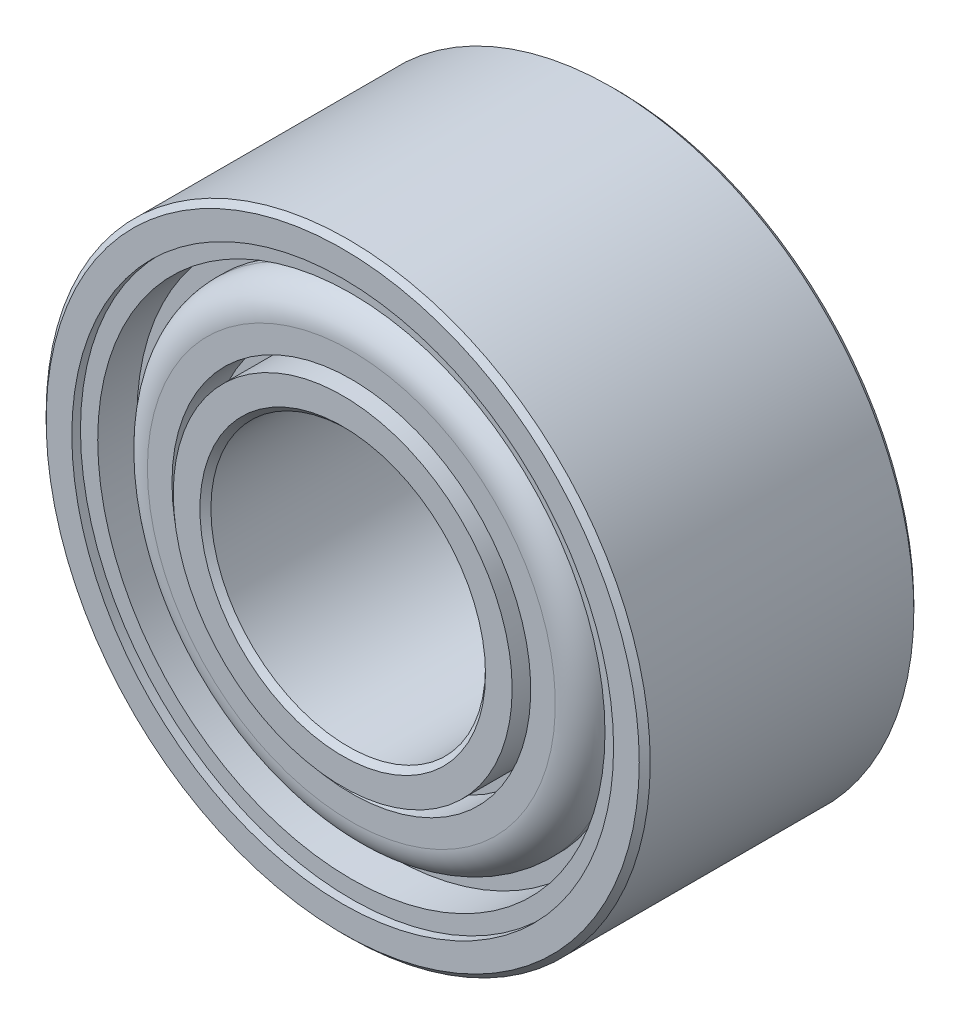
from build123d import *

# Parameters (mm, degrees)
SKETCH1_W     = 5
SKETCH1_H     = 3
FILLET1_R     = 0.6
CHAMFER1_SIZE = 0.1


with BuildPart() as part:
    # Sketch1 → Revolve1 (revolve)
    with BuildSketch(Plane(origin=(0, 0, 0), x_dir=(0, 0, -1), z_dir=(1, 0, 0))):
        with Locations((0, 4)):
            Rectangle(SKETCH1_W, SKETCH1_H)
    revolve(axis=Axis((0, 0, 0), (0, 0, 1)))

    # Sketch2 → Cut-Revolve1 (revolve, cut)
    with BuildSketch(Plane(origin=(0, 0, 0), x_dir=(0, 0, -1), z_dir=(1, 0, 0))):
        Polygon((2.342552915, 4.932692724), (2.342552915, 4.618447821), (1.628359953, 4.618447821), (1.628359953, 4.31372549), (2.342552915, 4.31372549), (2.342552915, 3.266242479), (1.628359953, 3.266242479), (1.628359953, 3.085313596), (3.190061897, 3.085313596), (3.190061897, 4.932692724), align=None)
        Polygon((-3.190061897, 4.932692724), (-2.342552915, 4.932692724), (-2.342552915, 4.618447821), (-1.628359953, 4.618447821), (-1.628359953, 4.31372549), (-2.342552915, 4.31372549), (-2.342552915, 3.266242479), (-1.628359953, 3.266242479), (-1.628359953, 3.085313596), (-3.190061897, 3.085313596), align=None)
    revolve(axis=Axis((0, 0, 0), (0, 0, 1)), mode=Mode.SUBTRACT)

    # Fillet1
    fillet1_edges = [part.edges().sort_by_distance(p)[0] for p in [
        (0, -4.31372549, 2.342552915),
        (0, -4.31372549, -2.342552915),
    ]]
    fillet(fillet1_edges, radius=FILLET1_R)

    # Chamfer1
    chamfer1_edges = [part.edges().sort_by_distance(p)[0] for p in [
        (0, -2.5, 2.5),
        (0, -2.5, -2.5),
        (0, -5.5, 2.5),
        (0, -5.5, -2.5),
    ]]
    chamfer(chamfer1_edges, length=CHAMFER1_SIZE)


solid = part.part
